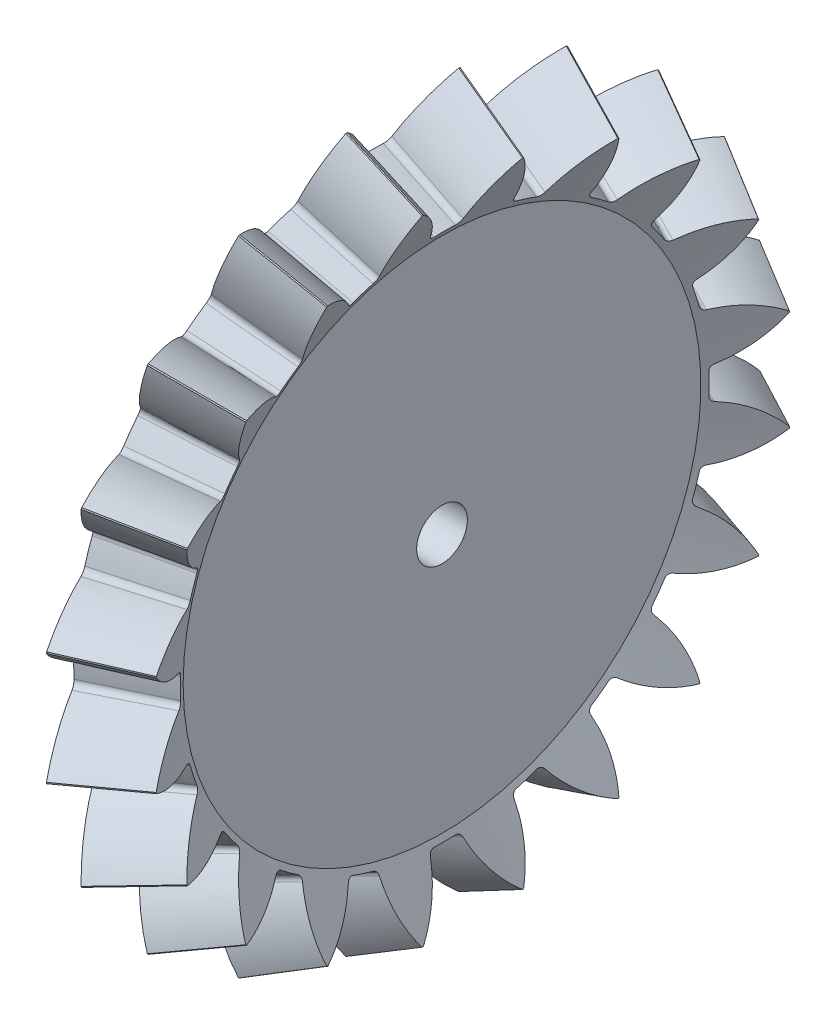
from build123d import *

# Parameters (mm, degrees)
TOOCUTSKE2_R    = 0.0127
TEETHCUTS_COUNT = 20
TEETHCUTS_ANGLE = 342
HUBSKE_R        = 15.24
HUB_DEPTH       = 0.0001016
BORSKE_R        = 4
BORE_DEPTH      = 104.022405601


with BuildPart() as part:
    # BasProSke → Base-Revolve (revolve)
    with BuildSketch(Plane(origin=(0, 0, 0), x_dir=(1, 0, 0), z_dir=(0, 1, 0))):
        Polygon((0, 0), (0, 45.9552904), (5.477986419, 56.911263224), (16.495581741, 50.548390554), (11.630052823, 40.817332731), (11.630052823, 0), align=None)
    revolve(axis=Axis((-10, 0, 0), (1, 0, 0)))

    # TooCutSke2 → ToothCut section 0
    with BuildSketch(Plane(origin=(83.217883799, -41.608941954, 0), x_dir=(0, 0, 1), z_dir=(-0.8944271907629874, 0.44721359597381516, 0))):
        with Locations((0, 46.520211293)):
            Circle(TOOCUTSKE2_R)
    # TooCutSke → ToothCut section 1
    with BuildSketch(Plane(origin=(2.73899321, 51.433276812, 0), x_dir=(0, 0, -1), z_dir=(-0.8944271907629872, 0.4472135959738154, 0))):
        with BuildLine():
            ThreePointArc((-9.885347335, -6.440104916), (0, -7.277227), (9.885347335, -6.440104916))
            ThreePointArc((9.885347335, -6.440104916), (5.518250901, -1.622712271), (2.896400677, 4.327472983))
            ThreePointArc((2.896400677, 4.327472983), (2.521961057, 4.882387183), (1.882179371, 5.079400363))
            ThreePointArc((1.882179371, 5.079400363), (0, 5.041265), (-1.882179371, 5.079400363))
            ThreePointArc((-1.882179371, 5.079400363), (-2.521961057, 4.882387183), (-2.896400677, 4.327472983))
            ThreePointArc((-2.896400677, 4.327472983), (-5.518250901, -1.622712271), (-9.885347335, -6.440104916))
        make_face()
    toothcut = loft(mode=Mode.SUBTRACT)

    # TeethCuts: ToothCut ×20 about axis
    teethcuts_axis = Axis((-10, 0, 0), (1, 0, 0))
    for i in range(1, TEETHCUTS_COUNT):
        add(toothcut.rotate(teethcuts_axis, i * TEETHCUTS_ANGLE / (TEETHCUTS_COUNT - 1)), mode=Mode.SUBTRACT)

    # HubSke → Hub (add)
    with BuildSketch(Plane.ZY):
        Circle(HUBSKE_R)
    extrude(amount=HUB_DEPTH)

    # BorSke → Bore (cut, symmetric)
    with BuildSketch(Plane(origin=(0, 0, 0), x_dir=(0, 0, -1), z_dir=(1, 0, 0))):
        Circle(BORSKE_R)
    extrude(amount=BORE_DEPTH, both=True, mode=Mode.SUBTRACT)


solid = part.part
